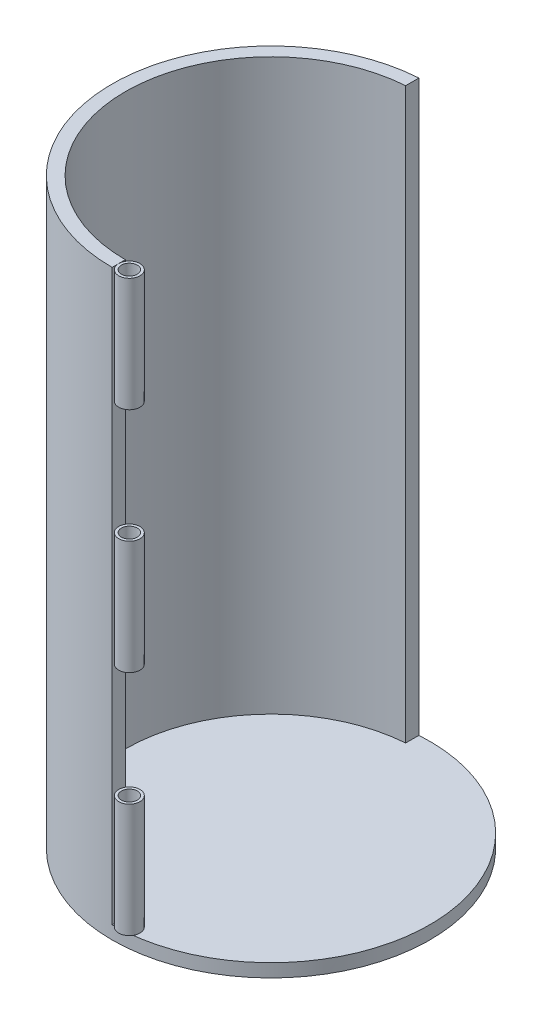
from build123d import *

# Parameters (mm, degrees)
SKETCH1_R           = 30
BOSS_EXTRUDE1_DEPTH = 2.5
SKETCH2_R           = 30
SKETCH2_R_2         = 27.5
BOSS_EXTRUDE2_DEPTH = 107.5
CUT_EXTRUDE1_START  = -107.5
CUT_EXTRUDE1_DEPTH  = 107.5
SKETCH6_R           = 2
SKETCH6_R_2         = 1.5
BOSS_EXTRUDE9_DEPTH = 21.5
LPATTERN1_COUNT     = 3
LPATTERN1_PITCH     = 43
CUT_EXTRUDE2_START  = -107.5
CUT_EXTRUDE2_DEPTH  = 107.5


# Read off the part's stored shape, not the designer's step: Cut-Extrude2
with BuildPart() as part:
    # Sketch1 → Boss-Extrude1 (new body)
    with BuildSketch(Plane(origin=(0, 0, 0), x_dir=(1, 0, 0), z_dir=(0, 1, 0))):
        with Locations(Location((0, 0, 0), (0, 0, 270))):
            Circle(SKETCH1_R)
    extrude(amount=BOSS_EXTRUDE1_DEPTH)

    # Sketch2 → Boss-Extrude2 (add)
    with BuildSketch(Plane(origin=(0, 2.5, 0), x_dir=(1, 0, 0), z_dir=(0, 1, 0))):
        with Locations(Location((0, 0, 0), (0, 0, 270))):
            Circle(SKETCH2_R)
        with Locations(Location((0, 0, 0), (0, 0, 270))):
            Circle(SKETCH2_R_2, mode=Mode.SUBTRACT)
    extrude(amount=BOSS_EXTRUDE2_DEPTH)

    # Sketch3 → Cut-Extrude1 (cut)
    with BuildSketch(Plane(origin=(0, 110, 0), x_dir=(1, 0, 0), z_dir=(0, 1, 0)).offset(CUT_EXTRUDE1_START)):
        with BuildLine():
            Line((0, -30), (0, 30))
            ThreePointArc((0, 30), (30, 0), (0, -30))
        make_face()
    extrude(amount=CUT_EXTRUDE1_DEPTH, mode=Mode.SUBTRACT)

    # Cut-Extrude2 outline → Cut-Extrude2 (cut)
    with BuildSketch(Plane(origin=(0, 110, 0), x_dir=(1, 0, 0), z_dir=(0, 1, 0)).offset(CUT_EXTRUDE2_START)):
        with BuildLine():
            ThreePointArc((0, 30), (-1.000556639, 29.983310131), (-2, 29.933259094))
            Line((-2, 29.933259094), (-2, 27.427176304))
            ThreePointArc((-2, 27.427176304), (-1.000662692, 27.481788045), (0, 27.5))
            Line((0, 27.5), (0, 30))
        make_face()
    extrude(amount=CUT_EXTRUDE2_DEPTH, mode=Mode.SUBTRACT)


with BuildPart() as body_2:
    # Sketch6 → Boss-Extrude9 (new body)
    with BuildSketch(Plane(origin=(0, 2.5, 0), x_dir=(1, 0, 0), z_dir=(0, 1, 0))):
        with Locations(Location((2, -28.75, 0), (0, 0, 270))):
            Circle(SKETCH6_R)
        with Locations(Location((2, -28.75, 0), (0, 0, 270))):
            Circle(SKETCH6_R_2, mode=Mode.SUBTRACT)
    boss_extrude9 = extrude(amount=BOSS_EXTRUDE9_DEPTH)


with BuildPart() as lpattern1_1:
    # LPattern1: Boss-Extrude9 ×3
    with Locations(*[(0, i * LPATTERN1_PITCH, 0) for i in range(1, LPATTERN1_COUNT)]):
        add(boss_extrude9)


solid = Compound([part.part, body_2.part, lpattern1_1.part])
